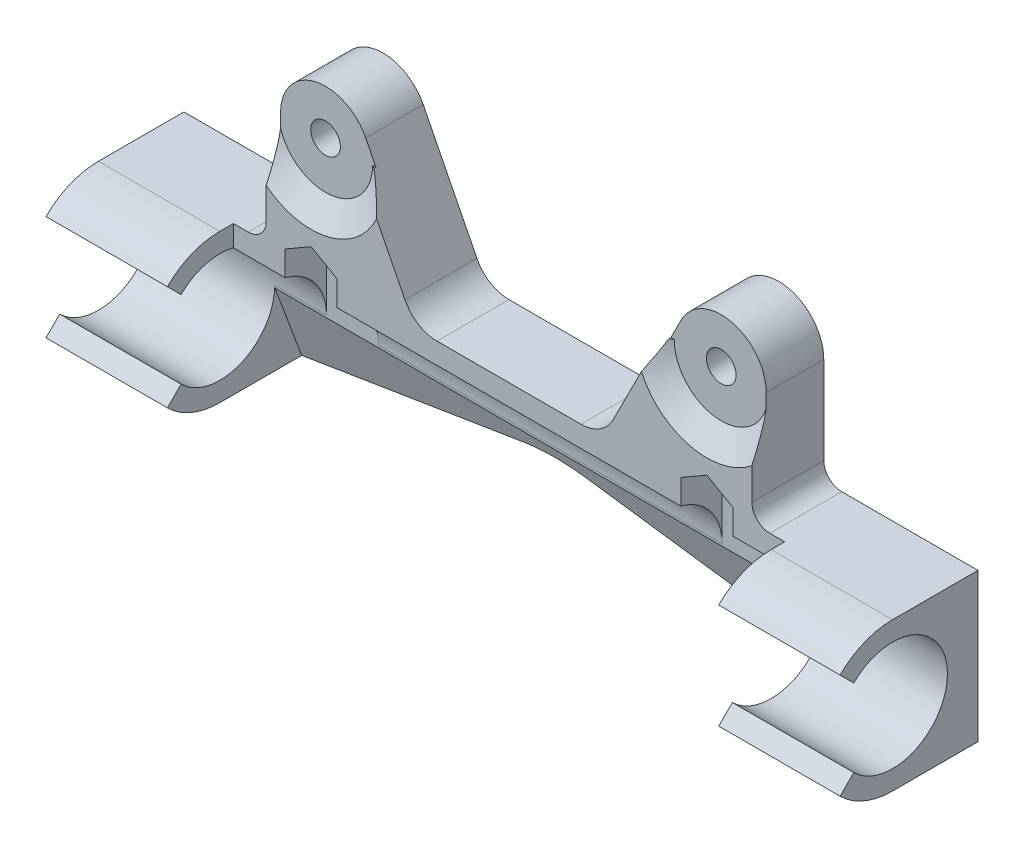
from build123d import *

# Parameters (mm, degrees)
BOSS_EXTRUDE1_DEPTH = 88.3
SKETCH6_R           = 1.65
BOSS_EXTRUDE2_DEPTH = 8
CUT_EXTRUDE1_DEPTH  = 93.261259475
SKETCH8_W           = 61.3
SKETCH8_H           = 21.483950942
CUT_EXTRUDE2_DEPTH  = 93.118890571
SKETCH9_W           = 61.3
SKETCH9_H           = 11.699409457
CUT_EXTRUDE3_DEPTH  = 93.543511645
SKETCH10_R          = 1.65
CUT_EXTRUDE4_DEPTH  = 94.043055829
CHAMFER1_SIZE       = 8
CHAMFER1_SIZE2      = 3
CUT_EXTRUDE5_DEPTH  = 93.54351174
FILLET1_R           = 2
CUT_EXTRUDE6_DEPTH  = 3
CUT_EXTRUDE7_START  = -4.6
CUT_EXTRUDE7_DEPTH  = 4.6
CUT_EXTRUDE8_START  = -1.6
CUT_EXTRUDE8_DEPTH  = 1.6
CHAMFER2_SIZE       = 1.732050808
CHAMFER2_SIZE_2     = 3


with BuildPart() as part:
    # Sketch1 → Boss-Extrude1 (new body)
    with BuildSketch(Plane.ZY):
        with BuildLine():
            Line((-9.5, 8.25), (-9.5, -8.25))
            Line((-9.5, -8.25), (0, -8.25))
            ThreePointArc((0, -8.25), (8.25, 0), (0, 8.25))
            Line((0, 8.25), (-9.5, 8.25))
        make_face()
    extrude(amount=BOSS_EXTRUDE1_DEPTH)

    # Sketch6 → Boss-Extrude2 (add)
    with BuildSketch(Plane(origin=(0, 0, -9.5), x_dir=(-1, 0, 0), z_dir=(0, 0, -1))):
        with BuildLine():
            Line((17.15, -8.25), (17.15, 20))
            ThreePointArc((17.15, 20), (20.99096395, 24.863808737), (26.612654174, 22.254931867))
            Line((26.612654174, 22.254931867), (32.579554775, 10.446054507))
            ThreePointArc((32.579554775, 10.446054507), (34.053942202, 8.842964487), (36.149678114, 8.25))
            Line((36.149678114, 8.25), (52.150321886, 8.25))
            ThreePointArc((52.150321886, 8.25), (54.246057798, 8.842964487), (55.720445225, 10.446054507))
            Line((55.720445225, 10.446054507), (61.687345826, 22.254931867))
            ThreePointArc((61.687345826, 22.254931867), (67.30903605, 24.863808737), (71.15, 20))
            Line((71.15, 20), (71.15, -8.25))
            Line((71.15, -8.25), (17.15, -8.25))
        make_face()
        with Locations((22.15, 20)):
            Circle(SKETCH6_R, mode=Mode.SUBTRACT)
        with Locations(Location((66.15, 20, 0), (0, 0, 180))):
            Circle(SKETCH6_R, mode=Mode.SUBTRACT)
    extrude(amount=-BOSS_EXTRUDE2_DEPTH)

    # Sketch7 → Cut-Extrude1 (cut, through all)
    with BuildSketch(Plane.ZY.offset(88.3)):
        with BuildLine():
            Line((13.481907846, 13.481907846), (4.313351365, 4.313351365))
            ThreePointArc((4.313351365, 4.313351365), (-6.1, 0), (4.313351365, -4.313351365))
            Line((4.313351365, -4.313351365), (13.481907846, -13.481907846))
            Line((13.481907846, -13.481907846), (13.481907846, 13.481907846))
        make_face()
    extrude(amount=-CUT_EXTRUDE1_DEPTH, mode=Mode.SUBTRACT)

    # Sketch8 → Cut-Extrude2 (cut, through all)
    with BuildSketch(Plane.XY.offset(-1.5)):
        with Locations((-44.15, -2.491975471)):
            Rectangle(SKETCH8_W, SKETCH8_H)
    extrude(amount=CUT_EXTRUDE2_DEPTH, mode=Mode.SUBTRACT)

    # Sketch9 → Cut-Extrude3 (cut, through all)
    with BuildSketch(Plane(origin=(0, 0, -6.1), x_dir=(-1, 0, 0), z_dir=(0, 0, -1))):
        with Locations((44.15, -5.849704729)):
            Rectangle(SKETCH9_W, SKETCH9_H)
    extrude(amount=-CUT_EXTRUDE3_DEPTH, mode=Mode.SUBTRACT)

    # Sketch10 → Cut-Extrude4 (cut, through all)
    with BuildSketch(Plane(origin=(0, 0, -9.5), x_dir=(-1, 0, 0), z_dir=(0, 0, -1))):
        with Locations((22.15, 7)):
            Circle(SKETCH10_R)
        with Locations((66.15, 7)):
            Circle(SKETCH10_R)
    extrude(amount=-CUT_EXTRUDE4_DEPTH, mode=Mode.SUBTRACT)

    # Chamfer1
    chamfer1_edges = [part.edges().sort_by_distance(p)[0] for p in [
        (-44.15, -8.25, -6.1),
    ]]
    chamfer1_side = [part.faces().sort_by_distance(p)[0] for p in [
        (-44.15, -4.125, -6.1),
    ]]
    chamfer(chamfer1_edges, length=CHAMFER1_SIZE, length2=CHAMFER1_SIZE2, reference=chamfer1_side[0])

    # Sketch11 → Cut-Extrude5 (cut, through all)
    with BuildSketch(Plane(origin=(0, 0, -6.1), x_dir=(-1, 0, 0), z_dir=(0, 0, -1))):
        with BuildLine():
            Line((74.8, -8.25), (47.5958626, -1.828822614))
            ThreePointArc((47.5958626, -1.828822614), (44.15, -1.427659244), (40.7041374, -1.828822614))
            Line((40.7041374, -1.828822614), (13.5, -8.25))
            Line((13.5, -8.25), (13.5, -16.427659244))
            Line((13.5, -16.427659244), (74.8, -16.427659244))
            Line((74.8, -16.427659244), (74.8, -8.25))
        make_face()
    extrude(amount=CUT_EXTRUDE5_DEPTH, mode=Mode.SUBTRACT)

    # Fillet1
    fillet1_edges = [part.edges().sort_by_distance(p)[0] for p in [
        (-17.15, 8.25, -5.5),
        (-71.15, 8.25, -5.5),
    ]]
    fillet(fillet1_edges, radius=FILLET1_R)

    # Sketch12 → Cut-Extrude6 (cut)
    with BuildSketch(Plane(origin=(0, 0, -9.5), x_dir=(-1, 0, 0), z_dir=(0, 0, -1))):
        Polygon((22.15, 16.651368439), (25.05, 18.325684219), (25.05, 21.674315781), (22.15, 23.348631561), (19.25, 21.674315781), (19.25, 18.325684219), align=None)
        Polygon((66.15, 16.651368439), (69.05, 18.325684219), (69.05, 21.674315781), (66.15, 23.348631561), (63.25, 21.674315781), (63.25, 18.325684219), align=None)
    extrude(amount=-CUT_EXTRUDE6_DEPTH, mode=Mode.SUBTRACT)

    # Sketch13 → Cut-Extrude7 (cut)
    with BuildSketch(Plane.XY.offset(-1.5).offset(CUT_EXTRUDE7_START)):
        Polygon((-69.05, -2.12397244), (-63.25, -2.12397244), (-63.25, 8.674315781), (-66.15, 10.348631561), (-69.05, 8.674315781), align=None)
        Polygon((-25.05, -2.12397244), (-19.25, -2.12397244), (-19.25, 8.674315781), (-22.15, 10.348631561), (-25.05, 8.674315781), align=None)
    extrude(amount=CUT_EXTRUDE7_DEPTH, mode=Mode.SUBTRACT)

    # Sketch14 → Cut-Extrude8 (cut)
    with BuildSketch(Plane.XY.offset(-1.5).offset(CUT_EXTRUDE8_START)):
        with BuildLine():
            Line((-61.15, 20), (-27.15, 20))
            ThreePointArc((-27.15, 20), (-18.614466094, 16.464466094), (-22.15, 25))
            Line((-22.15, 25), (-66.15, 25))
            ThreePointArc((-66.15, 25), (-69.685533906, 16.464466094), (-61.15, 20))
        make_face()
    extrude(amount=CUT_EXTRUDE8_DEPTH, mode=Mode.SUBTRACT)

    # Chamfer2
    # the kernel refuses this chamfer: 3, 1.732050808 mm, written as the material it takes off along each edge
    with BuildSketch(Plane(origin=(-22.15, 20, -1.5), x_dir=(-0.016047871272964892, 0.9998712246222542, 0), z_dir=(0.9998712246222542, 0.016047871272964892, 0))) as chamfer2_piece_1_section:
        Polygon((5, -CHAMFER2_SIZE), (5 + CHAMFER2_SIZE_2, 0), (5, 0), align=None)
    chamfer2_piece_1 = revolve(axis=Axis((-22.15, 20, -1.5), (0, 0, 1)), revolution_arc=358.160970471, mode=Mode.PRIVATE)
    chamfer2_piece_1 = split(chamfer2_piece_1, bisect_by=Plane(origin=(-17.15, 16.005759066, -2.231169886), z_dir=(-1, 0, 0)), keep=Keep.TOP, mode=Mode.PRIVATE)
    chamfer2_piece_1 = split(chamfer2_piece_1, bisect_by=Plane(origin=(-27.459187994, 16.005759066, -3.1), z_dir=(0, 0, 1)), keep=Keep.TOP, mode=Mode.PRIVATE)
    add(chamfer2_piece_1, mode=Mode.SUBTRACT)
    with BuildSketch(Plane(origin=(-22.15, 20, -1.5), x_dir=(-0.016047871272964892, 0.9998712246222542, 0), z_dir=(0.9998712246222542, 0.016047871272964892, 0))) as chamfer2_piece_2_section:
        Polygon((5, -CHAMFER2_SIZE), (5 + CHAMFER2_SIZE_2, 0), (5, 0), align=None)
    chamfer2_piece_2 = revolve(axis=Axis((-22.15, 20, -1.5), (0, 0, 1)), revolution_arc=358.160970471, mode=Mode.PRIVATE)
    chamfer2_piece_2 = split(chamfer2_piece_2, bisect_by=Plane(origin=(-17.15, 20, -1.92443376), z_dir=(1, 0, 0)), keep=Keep.TOP, mode=Mode.PRIVATE)
    chamfer2_piece_2 = split(chamfer2_piece_2, bisect_by=Plane(origin=(-16.215864926, 20, -3.1), z_dir=(0, 0, 1)), keep=Keep.TOP, mode=Mode.PRIVATE)
    add(chamfer2_piece_2, mode=Mode.SUBTRACT)
    with BuildSketch(Plane(origin=(-66.15, 20, -1.5), x_dir=(-0.016047871272962772, 0.9998712246222542, 0), z_dir=(0.9998712246222542, 0.016047871272962772, 0))) as chamfer2_piece_3_section:
        Polygon((5, -CHAMFER2_SIZE), (5 + CHAMFER2_SIZE_2, 0), (5, 0), align=None)
    chamfer2_piece_3 = revolve(axis=Axis((-66.15, 20, -1.5), (0, 0, 1)), revolution_arc=358.160970471, mode=Mode.PRIVATE)
    chamfer2_piece_3 = split(chamfer2_piece_3, bisect_by=Plane(origin=(-70.144240933, 25.309187993, -3.1), z_dir=(0, 0, 1)), keep=Keep.TOP, mode=Mode.PRIVATE)
    chamfer2_piece_3 = split(chamfer2_piece_3, bisect_by=Plane(origin=(-71.15, 25.309187993, -2.231169885), z_dir=(1, 0, 0)), keep=Keep.TOP, mode=Mode.PRIVATE)
    add(chamfer2_piece_3, mode=Mode.SUBTRACT)
    with BuildSketch(Plane(origin=(-66.15, 20, -1.5), x_dir=(-0.016047871272962772, 0.9998712246222542, 0), z_dir=(0.9998712246222542, 0.016047871272962772, 0))) as chamfer2_piece_4_section:
        Polygon((5, -CHAMFER2_SIZE), (5 + CHAMFER2_SIZE_2, 0), (5, 0), align=None)
    chamfer2_piece_4 = revolve(axis=Axis((-66.15, 20, -1.5), (0, 0, 1)), revolution_arc=358.160970471, mode=Mode.PRIVATE)
    chamfer2_piece_4 = split(chamfer2_piece_4, bisect_by=Plane(origin=(-72.084135074, 20, -3.1), z_dir=(0, 0, 1)), keep=Keep.TOP, mode=Mode.PRIVATE)
    chamfer2_piece_4 = split(chamfer2_piece_4, bisect_by=Plane(origin=(-71.15, 20, -1.92443376), z_dir=(-1, 0, 0)), keep=Keep.TOP, mode=Mode.PRIVATE)
    add(chamfer2_piece_4, mode=Mode.SUBTRACT)


solid = part.part
